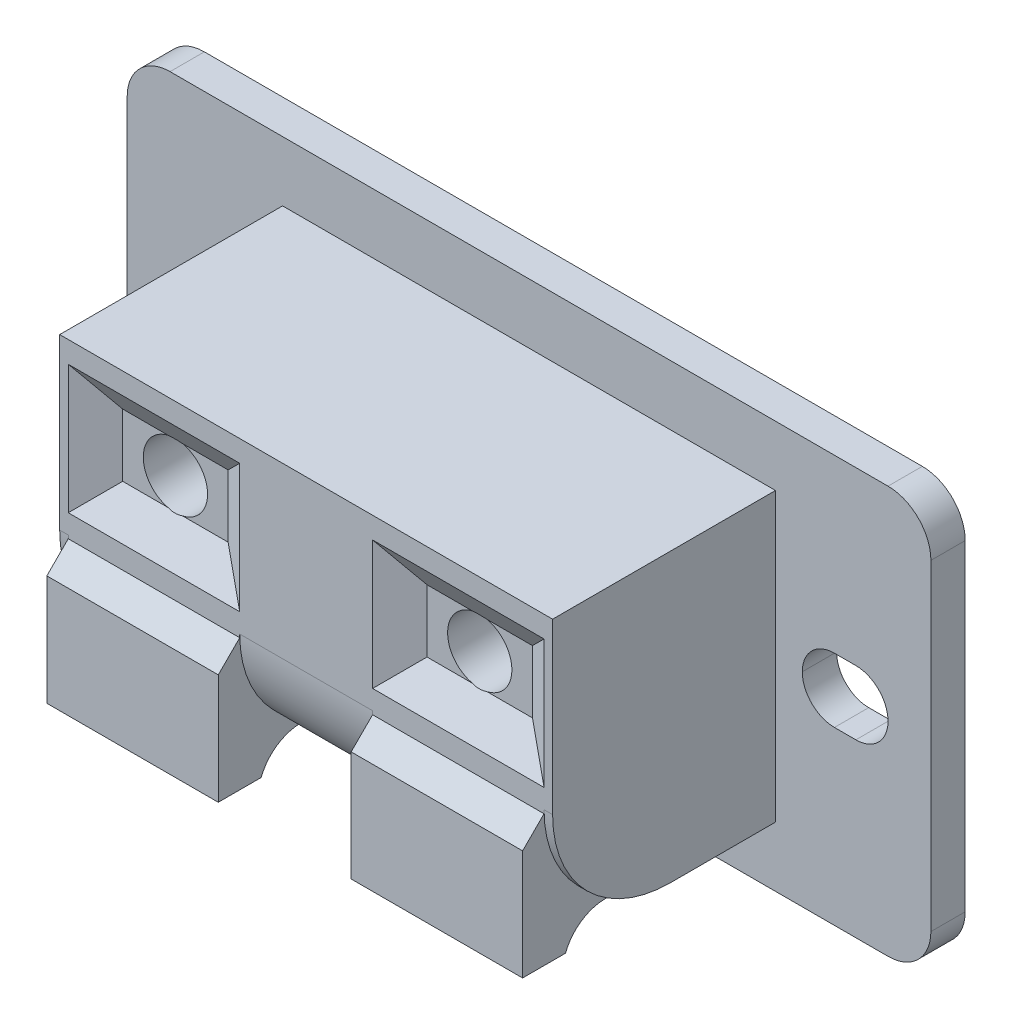
from build123d import *

# Parameters (mm, degrees)
SKETCH_2_W                    = 37.5
SKETCH_2_H                    = 19
EXTRUDE_1_DEPTH               = 1.6
SKETCH_3_W                    = 23
SKETCH_3_H                    = 13.4
EXTRUDE_2_DEPTH               = 10.4
FILLET_1_R                    = 2
SKETCH_4_W                    = 4
SKETCH_4_H                    = 3
CUT_EXTRUDE_1_DEPTH           = 1.6
FILLET_2_R                    = 1.5
SKETCH_5_R                    = 1.5
CUT_EXTRUDE_2_DEPTH           = 5
SKETCH_6_W                    = 8
SKETCH_6_H                    = 6
CUT_EXTRUDE_3_DEPTH           = 1
CUT_EXTRUDE_3_DRAFT           = -57
CUT_EXTRUDE_3_PROFILE_2_DEPTH = 1
CUT_EXTRUDE_3_PROFILE_2_DRAFT = -57
FILLET_3_R                    = 5.5
SKETCH_7_W                    = 8
SKETCH_7_H                    = 7
EXTRUDE_3_DEPTH               = 1
SKETCH_8_W                    = 8
SKETCH_8_H                    = 3.15
SKETCH_8_H_2                  = 3.13772234
EXTRUDE_4_DEPTH               = 1
FILLET_4_R                    = 2
SKETCH_9_W                    = 3
SKETCH_9_H                    = 0.2
EXTRUDE_5_DEPTH               = 2
SKETCH_10_W                   = 3
SKETCH_10_H                   = 7
EXTRUDE_6_DEPTH               = 0.2
SKETCH_11_W                   = 1.5
SKETCH_11_H                   = 3
CUT_EXTRUDE_4_DEPTH           = 0.2
FILLET_5_R                    = 0.75


# Some blends are built 0.0001 mm under size
with BuildPart() as part:
    # Эскиз2 → Бобышка-Вытянуть1 (new body)
    with BuildSketch(Plane.XY):
        Rectangle(SKETCH_2_W, SKETCH_2_H)
    extrude(amount=EXTRUDE_1_DEPTH)

    # Эскиз3 → Бобышка-Вытянуть2 (add)
    with BuildSketch(Plane.XY.offset(1.6)):
        Rectangle(SKETCH_3_W, SKETCH_3_H)
    extrude(amount=EXTRUDE_2_DEPTH)

    # Скругление1
    fillet_1_edges = [part.edges().sort_by_distance(p)[0] for p in [
        (-18.75, 9.5, 0.8),
        (18.75, 9.5, 0.8),
        (18.75, -9.5, 0.8),
        (-18.75, -9.5, 0.8),
    ]]
    fillet(fillet_1_edges, radius=FILLET_1_R)

    # Эскиз4 → Вырез-Вытянуть1 (cut)
    with BuildSketch(Plane.XY.offset(1.6)):
        with Locations((14.75, 0)):
            Rectangle(SKETCH_4_W, SKETCH_4_H)
        with Locations((-14.75, 0)):
            Rectangle(SKETCH_4_W, SKETCH_4_H)
    extrude(amount=-CUT_EXTRUDE_1_DEPTH, mode=Mode.SUBTRACT)

    # Скругление2
    fillet_2_edges = [part.edges().sort_by_distance(p)[0] for p in [
        (-16.75, 1.5, 0.8),
        (-12.75, 1.5, 0.8),
        (16.75, 1.5, 0.8),
        (16.75, -1.5, 0.8),
        (-12.75, -1.5, 0.8),
        (-16.75, -1.5, 0.8),
        (12.75, -1.5, 0.8),
        (12.75, 1.5, 0.8),
    ]]
    fillet(fillet_2_edges, radius=FILLET_2_R - 0.0001)  # a hair under: the kernel refuses the full size

    # Эскиз5 → Вырез-Вытянуть2 (cut)
    with BuildSketch(Plane.XY.offset(12)):
        with Locations((-7.1, 2.7)):
            Circle(SKETCH_5_R)
        with Locations((7.1, 2.7)):
            Circle(SKETCH_5_R)
    extrude(amount=-CUT_EXTRUDE_2_DEPTH, mode=Mode.SUBTRACT)


with BuildPart() as cut_extrude_3_tool:
    # Эскиз6 → Вырез-Вытянуть3 (with draft: the straight prism first)
    with BuildSketch(Plane.XY.offset(12)):
        with Locations((-7.1, 2.7)):
            Rectangle(SKETCH_6_W, SKETCH_6_H)
    extrude(amount=-CUT_EXTRUDE_3_DEPTH)
    # Вырез-Вытянуть3: the draft: its side faces are tilted about the plane it starts from
    cut_extrude_3_sides = [cut_extrude_3_tool.faces().sort_by_distance(p)[0] for p in [
        (-11.1, 2.7, 11.5),
        (-7.1, -0.3, 11.5),
        (-3.1, 2.7, 11.5),
        (-7.1, 5.7, 11.5),
    ]]
    draft(cut_extrude_3_sides, Plane.XY.offset(12), CUT_EXTRUDE_3_DRAFT)


with BuildPart() as part_1:
    add(part.part)

    # Вырез-Вытянуть3: cut by cut_extrude_3_tool
    add(cut_extrude_3_tool.part, mode=Mode.SUBTRACT)


with BuildPart() as cut_extrude_3_profile_2_tool:
    # Эскиз6 → Вырез-Вытянуть3 profile 2 (with draft: the straight prism first)
    with BuildSketch(Plane.XY.offset(12)):
        with Locations((7.1, 2.7)):
            Rectangle(SKETCH_6_W, SKETCH_6_H)
    extrude(amount=-CUT_EXTRUDE_3_PROFILE_2_DEPTH)
    # Вырез-Вытянуть3 profile 2: the draft: its side faces are tilted about the plane it starts from
    cut_extrude_3_profile_2_sides = [cut_extrude_3_profile_2_tool.faces().sort_by_distance(p)[0] for p in [
        (3.1, 2.7, 11.5),
        (7.1, -0.3, 11.5),
        (11.1, 2.7, 11.5),
        (7.1, 5.7, 11.5),
    ]]
    draft(cut_extrude_3_profile_2_sides, Plane.XY.offset(12), CUT_EXTRUDE_3_PROFILE_2_DRAFT)


with BuildPart() as part_2:
    add(part_1.part)

    # Вырез-Вытянуть3 profile 2: cut by cut_extrude_3_profile_2_tool
    add(cut_extrude_3_profile_2_tool.part, mode=Mode.SUBTRACT)

    # Скругление3
    fillet_3_edges = [part_2.edges().sort_by_distance(p)[0] for p in [
        (0, -6.7, 12),
    ]]
    fillet(fillet_3_edges, radius=FILLET_3_R)

    # Эскиз7 → Бобышка-Вытянуть3 (add)
    with BuildSketch(Plane.XY.offset(12)):
        with Locations((-7.1, -4)):
            Rectangle(SKETCH_7_W, SKETCH_7_H)
        with Locations((7.1, -4)):
            Rectangle(SKETCH_7_W, SKETCH_7_H)
    extrude(amount=-EXTRUDE_3_DEPTH)

    # Эскиз8 → Бобышка-Вытянуть4 (add)
    with BuildSketch(Plane.XY.offset(12)):
        with Locations((-7.1, -5.925)):
            Rectangle(SKETCH_8_W, SKETCH_8_H)
        with Locations((7.1, -5.93113883)):
            Rectangle(SKETCH_8_W, SKETCH_8_H_2)
    extrude(amount=EXTRUDE_4_DEPTH)

    # Фаска1
    # the kernel refuses this chamfer: 3 mm, written as the material it adds along each edge
    with BuildSketch(Plane(origin=(-3.1, -4.35, 12), x_dir=(0, 0.9996219169112968, -0.027495876610586202), z_dir=(-1, 0, 0))) as chamfer_1_piece_1_section:
        with BuildLine():
            Line((3.086019586, 0), (-0.169641465, -3.081353381))
            Line((-0.169641465, -3.081353381), (-0.22961878, -3.079703628))
            ThreePointArc((-0.22961878, -3.079703628), (-0.102387681, -1.540193489), (-0.059977315, 0.001649753))
            Line((-0.059977315, 0.001649753), (0.001649753, 0.059977315))
            ThreePointArc((0.001649753, 0.059977315), (1.543492994, 0.017566949), (3.087669338, 0.059977315))
            Line((3.087669338, 0.059977315), (3.086019586, 0))
        make_face()
    chamfer_1_piece_1 = extrude(amount=8, mode=Mode.PRIVATE)
    chamfer_1_piece_1 = split(chamfer_1_piece_1, bisect_by=Plane(origin=(-7.1, -3.063879333, 13), z_dir=(0, 0, -1)), keep=Keep.TOP, mode=Mode.PRIVATE)
    add(chamfer_1_piece_1)
    with BuildSketch(Plane(origin=(11.1, -4.36227766, 12), x_dir=(0, 0.9996219169112968, -0.027495876610586202), z_dir=(-1, 0, 0))) as chamfer_1_piece_2_section:
        with BuildLine():
            Line((3.086019586, 0), (-0.169641465, -3.081353381))
            Line((-0.169641465, -3.081353381), (-0.22961878, -3.079703628))
            ThreePointArc((-0.22961878, -3.079703628), (-0.102387681, -1.540193489), (-0.059977315, 0.001649753))
            Line((-0.059977315, 0.001649753), (0.001649753, 0.059977315))
            ThreePointArc((0.001649753, 0.059977315), (1.543492994, 0.017566949), (3.087669338, 0.059977315))
            Line((3.087669338, 0.059977315), (3.086019586, 0))
        make_face()
    chamfer_1_piece_2 = extrude(amount=8, mode=Mode.PRIVATE)
    chamfer_1_piece_2 = split(chamfer_1_piece_2, bisect_by=Plane(origin=(7.1, -3.076156993, 13), z_dir=(0, 0, -1)), keep=Keep.TOP, mode=Mode.PRIVATE)
    add(chamfer_1_piece_2)

    # Скругление4
    # the kernel refuses this fillet: 2 mm, written as the material it adds along each edge
    with BuildSketch(Plane(origin=(5.017202419, -4.36227766, 11), x_dir=(0, -0.6120158801433927, -0.7908454731819031), z_dir=(-1, 0, 0))) as fillet_4_piece_1_section:
        with BuildLine():
            CenterArc((3.837222962, 1.910888885), FILLET_4_R, 163.424275541, 89.407933075)
            Line((1.920335899, 2.481453509), (1.881998158, 2.492864801))
            ThreePointArc((1.881998158, 2.492864801), (0.928534131, 1.265207389), (-0.031633819, 0.024480635))
            Line((-0.031633819, 0.024480635), (0.01180684, -0.038217778))
            ThreePointArc((0.01180684, -0.038217778), (1.623440484, 0.205055567), (3.235074128, -0.038217778))
            Line((3.235074128, -0.038217778), (3.246880968, 0))
        make_face()
    fillet_4_piece_1 = extrude(amount=16.117202419, mode=Mode.PRIVATE)
    fillet_4_piece_1 = split(fillet_4_piece_1, bisect_by=Plane(origin=(3.1, -5.888894845, 10.384505844), z_dir=(1, 0, 0)), keep=Keep.TOP, mode=Mode.PRIVATE)
    add(fillet_4_piece_1)
    with BuildSketch(Plane(origin=(-3.1, -4.36227766, 11), x_dir=(0, -0.6120158801433927, -0.7908454731819031), z_dir=(-1, 0, 0))) as fillet_4_piece_2:
        with BuildLine():
            CenterArc((3.837222962, 1.910888885), FILLET_4_R, 163.424275541, 89.407933075)
            Line((1.920335899, 2.481453509), (1.881998158, 2.492864801))
            ThreePointArc((1.881998158, 2.492864801), (0.928534131, 1.265207389), (-0.031633819, 0.024480635))
            Line((-0.031633819, 0.024480635), (0.01180684, -0.038217778))
            ThreePointArc((0.01180684, -0.038217778), (1.623440484, 0.205055567), (3.235074128, -0.038217778))
            Line((3.235074128, -0.038217778), (3.246880968, 0))
        make_face()
    extrude(amount=8)
    with BuildSketch(Plane(origin=(11.1, -4.36227766, 11), x_dir=(0, -1, 0), z_dir=(-1, 0, 0))) as fillet_4_piece_3:
        with BuildLine():
            CenterArc((3.859659213, -1.865156066), FILLET_4_R, 111.159682929, 89.407933075)
            Line((1.987142713, -2.567781115), (1.949692383, -2.581833616))
            ThreePointArc((1.949692383, -2.581833616), (1.155738623, -1.158393294), (-0.022998383, -0.032727273))
            Line((-0.022998383, -0.032727273), (0, 0.04))
            ThreePointArc((0, 0.04), (1.56886117, 0.04), (3.123283602, 0.037303121))
            Line((3.123283602, 0.037303121), (3.13772234, 0))
        make_face()
    extrude(amount=8)
    with BuildSketch(Plane(origin=(11.1, -4.36227766, 11), x_dir=(0, -1, 0), z_dir=(-1, 0, 0))) as fillet_4_piece_4_section:
        with BuildLine():
            CenterArc((3.859659213, -1.865156066), FILLET_4_R, 111.159682929, 89.407933075)
            Line((1.987142713, -2.567781115), (1.949692383, -2.581833616))
            ThreePointArc((1.949692383, -2.581833616), (1.155738623, -1.158393294), (-0.022998383, -0.032727273))
            Line((-0.022998383, -0.032727273), (0, 0.04))
            ThreePointArc((0, 0.04), (1.56886117, 0.04), (3.123283602, 0.037303121))
            Line((3.123283602, 0.037303121), (3.13772234, 0))
        make_face()
    fillet_4_piece_4 = extrude(amount=16.117202419, mode=Mode.PRIVATE)
    fillet_4_piece_4 = split(fillet_4_piece_4, bisect_by=Plane(origin=(-3.1, -5.888894845, 10.384505844), z_dir=(-1, 0, 0)), keep=Keep.TOP, mode=Mode.PRIVATE)
    add(fillet_4_piece_4)

    # Эскиз9 → Бобышка-Вытянуть5 (add)
    with BuildSketch(Plane(origin=(0, 0, 0), x_dir=(-1, 0, 0), z_dir=(0, 0, -1))):
        with Locations((-6.25, 5.4)):
            Rectangle(SKETCH_9_W, SKETCH_9_H)
        with Locations((6.25, 5.4)):
            Rectangle(SKETCH_9_W, SKETCH_9_H)
    extrude(amount=EXTRUDE_5_DEPTH)

    # Эскиз10 → Бобышка-Вытянуть6 (add)
    with BuildSketch(Plane(origin=(0, 0, -2), x_dir=(-1, 0, 0), z_dir=(0, 0, -1))):
        with Locations((-6.25, 2)):
            Rectangle(SKETCH_10_W, SKETCH_10_H)
        with Locations((6.25, 2)):
            Rectangle(SKETCH_10_W, SKETCH_10_H)
    extrude(amount=EXTRUDE_6_DEPTH)

    # Эскиз11 → Вырез-Вытянуть4 (cut)
    with BuildSketch(Plane(origin=(0, 0, -2.2), x_dir=(-1, 0, 0), z_dir=(0, 0, -1))):
        with Locations((-6.25, 0.75)):
            Rectangle(SKETCH_11_W, SKETCH_11_H)
        with Locations((6.25, 0.75)):
            Rectangle(SKETCH_11_W, SKETCH_11_H)
    extrude(amount=-CUT_EXTRUDE_4_DEPTH, mode=Mode.SUBTRACT)

    # Скругление5
    fillet_5_edges = [part_2.edges().sort_by_distance(p)[0] for p in [
        (-7, 2.25, -2.1),
        (-7, -0.75, -2.1),
        (5.5, -0.75, -2.1),
        (7, -0.75, -2.1),
        (-5.5, -0.75, -2.1),
        (-5.5, 2.25, -2.1),
        (4.75, -1.5, -2.1),
        (7, 2.25, -2.1),
        (7.75, -1.5, -2.1),
        (5.5, 2.25, -2.1),
        (-7.75, -1.5, -2.1),
        (-4.75, -1.5, -2.1),
    ]]
    fillet(fillet_5_edges, radius=FILLET_5_R - 0.0001)  # a hair under: the kernel refuses the full size


solid = part_2.part
